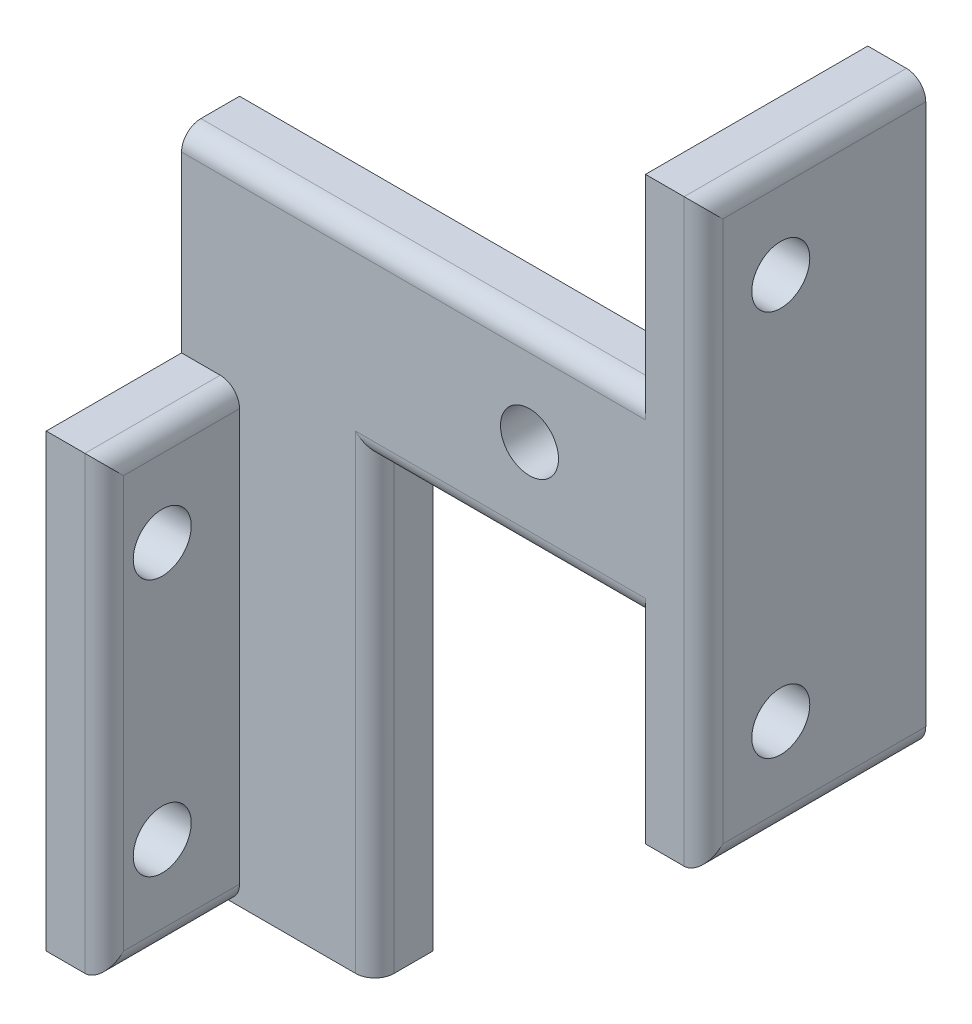
from build123d import *

# Parameters (mm, degrees)
CROQUIS1_W              = 23
CROQUIS1_H              = 33.3
SALIENTE_EXTRUIR2_DEPTH = 7
CROQUIS3_W              = 4
CROQUIS3_H              = 19
CORTAR_EXTRUIR1_DEPTH   = 42.071766458
CROQUIS7_R              = 1.5
SALIENTE_EXTRUIR3_DEPTH = 3
CROQUIS8_W              = 18
CROQUIS8_H              = 10
CROQUIS8_R              = 1.5
SALIENTE_EXTRUIR5_DEPTH = 3
SALIENTE_EXTRUIR6_START = -1
CROQUIS9_W              = 18
CROQUIS9_H              = 10
CROQUIS9_R              = 1.5
SALIENTE_EXTRUIR6_DEPTH = 1
CROQUIS10_W             = 23
CROQUIS10_H             = 10
SALIENTE_EXTRUIR7_DEPTH = 3
CROQUIS11_W             = 19
CROQUIS11_H             = 38
CORTAR_EXTRUIR5_DEPTH   = 57.449003534
CROQUIS15_W             = 7
CROQUIS15_H             = 10
CORTAR_EXTRUIR8_DEPTH   = 58.475994989
CROQUIS16_W             = 7
CROQUIS16_H             = 16
CORTAR_EXTRUIR9_DEPTH   = 1
CROQUIS18_W             = 23
CROQUIS18_H             = 10
CROQUIS18_R             = 1.5
SALIENTE_EXTRUIR8_DEPTH = 3
REDONDEO1_R             = 1
CROQUIS19_W             = 2
CROQUIS19_H             = 11.5
CORTAR_EXTRUIR10_DEPTH  = 67.516839973
CROQUIS20_W             = 11.5
CROQUIS20_H             = 11
CORTAR_EXTRUIR11_DEPTH  = 60.929041374


with BuildPart() as part:
    # Croquis1 → Saliente-Extruir2 (new body)
    with BuildSketch(Plane(origin=(0, 0, 0), x_dir=(0, 0, -1), z_dir=(1, 0, 0))):
        with Locations((-11.5, -16.65)):
            Rectangle(CROQUIS1_W, CROQUIS1_H)
    extrude(amount=SALIENTE_EXTRUIR2_DEPTH)

    # Croquis3 → Cortar-Extruir1 (cut, through all)
    with BuildSketch(Plane(origin=(0, 0, 0), x_dir=(1, 0, 0), z_dir=(0, 1, 0))):
        with Locations((5, -10.5)):
            Rectangle(CROQUIS3_W, CROQUIS3_H)
    extrude(amount=-CORTAR_EXTRUIR1_DEPTH, mode=Mode.SUBTRACT)



with BuildPart() as body_2:
    # Croquis7 → Saliente-Extruir3 (new body)
    with BuildSketch(Plane.ZY):
        Polygon((-7, 0), (-7, -33.3), (0, -33.3), (0, -44.3), (23, -44.3), (23, -33.3), (30, -33.3), (30, 0), align=None)
        with Locations((-4, -28.3)):
            Circle(CROQUIS7_R, mode=Mode.SUBTRACT)
        with Locations((-4, -15)):
            Circle(CROQUIS7_R, mode=Mode.SUBTRACT)
        with Locations((27, -15)):
            Circle(CROQUIS7_R, mode=Mode.SUBTRACT)
        with Locations((27, -28.3)):
            Circle(CROQUIS7_R, mode=Mode.SUBTRACT)
        with Locations((19, -40.3)):
            Circle(CROQUIS7_R, mode=Mode.SUBTRACT)
        with Locations((4, -40.3)):
            Circle(CROQUIS7_R, mode=Mode.SUBTRACT)
    extrude(amount=SALIENTE_EXTRUIR3_DEPTH)


with BuildPart() as part_1:
    add(part.part)

    add(body_2.part)  # Saliente-Extruir5 merges body 2
    # Croquis8 → Saliente-Extruir5 (add)
    with BuildSketch(Plane.XY.offset(23)):
        with Locations((9, -5)):
            Rectangle(CROQUIS8_W, CROQUIS8_H)
        with Locations((15, -5)):
            Circle(CROQUIS8_R, mode=Mode.SUBTRACT)
        with Locations((3, -5)):
            Circle(CROQUIS8_R, mode=Mode.SUBTRACT)
    extrude(amount=-SALIENTE_EXTRUIR5_DEPTH)

    # Croquis9 → Saliente-Extruir6 (add)
    with BuildSketch(Plane(origin=(0, 0, 0), x_dir=(-1, 0, 0), z_dir=(0, 0, -1)).offset(SALIENTE_EXTRUIR6_START)):
        with Locations((-9, -5)):
            Rectangle(CROQUIS9_W, CROQUIS9_H)
        with Locations(Location((-15, -5, 0), (0, 0, 180))):
            Circle(CROQUIS9_R, mode=Mode.SUBTRACT)
    extrude(amount=SALIENTE_EXTRUIR6_DEPTH)

    # Croquis10 → Saliente-Extruir7 (add)
    with BuildSketch(Plane(origin=(18, 0, 0), x_dir=(0, 0, -1), z_dir=(1, 0, 0))):
        with Locations((-11.5, -5)):
            Rectangle(CROQUIS10_W, CROQUIS10_H)
    extrude(amount=SALIENTE_EXTRUIR7_DEPTH)

    # Croquis11 → Cortar-Extruir5 (cut, through all)
    with BuildSketch(Plane(origin=(3, 0, 0), x_dir=(0, 0, -1), z_dir=(1, 0, 0))):
        with Locations((-10.5, -19)):
            Rectangle(CROQUIS11_W, CROQUIS11_H)
    extrude(amount=-CORTAR_EXTRUIR5_DEPTH, mode=Mode.SUBTRACT)

    # Croquis15 → Cortar-Extruir8 (cut, through all)
    with BuildSketch(Plane(origin=(0, 0, 0), x_dir=(0, 0, -1), z_dir=(1, 0, 0))):
        with Locations((-26.5, -5)):
            Rectangle(CROQUIS15_W, CROQUIS15_H)
        with Locations((3.5, -5)):
            Rectangle(CROQUIS15_W, CROQUIS15_H)
    extrude(amount=-CORTAR_EXTRUIR8_DEPTH, mode=Mode.SUBTRACT)

    # Croquis16 → Cortar-Extruir9 (cut)
    with BuildSketch(Plane(origin=(0, 0, 0), x_dir=(-1, 0, 0), z_dir=(0, 0, -1))):
        with Locations((-3.5, -25.3)):
            Rectangle(CROQUIS16_W, CROQUIS16_H)
    extrude(amount=-CORTAR_EXTRUIR9_DEPTH, mode=Mode.SUBTRACT)

    # Croquis18 → Saliente-Extruir8 (add)
    # profile 1 of 3: a face of its own
    with BuildSketch(Plane(origin=(21, 0, 0), x_dir=(0, 0, -1), z_dir=(1, 0, 0))):
        with Locations((-11.5, 5)):
            Rectangle(CROQUIS18_W, CROQUIS18_H)
        with Locations((-19, 5)):
            Circle(CROQUIS18_R, mode=Mode.SUBTRACT)
        with Locations((-4, 5)):
            Circle(CROQUIS18_R, mode=Mode.SUBTRACT)
    # profile 2 of 3: a face of its own
    with BuildSketch(Plane(origin=(21, 0, 0), x_dir=(0, 0, -1), z_dir=(1, 0, 0))):
        with Locations((-11.5, -5)):
            Rectangle(CROQUIS18_W, CROQUIS18_H)
    # profile 3 of 3: a face of its own
    with BuildSketch(Plane(origin=(21, 0, 0), x_dir=(0, 0, -1), z_dir=(1, 0, 0))):
        with Locations((-11.5, -15)):
            Rectangle(CROQUIS18_W, CROQUIS18_H)
        with Locations((-4, -15)):
            Circle(CROQUIS18_R, mode=Mode.SUBTRACT)
        with Locations((-19, -15)):
            Circle(CROQUIS18_R, mode=Mode.SUBTRACT)
    extrude(amount=SALIENTE_EXTRUIR8_DEPTH)

    # Redondeo1
    # the kernel refuses this fillet: 1 mm, written as the material it takes off along each edge
    with BuildSketch(Plane(origin=(0, -33.3, 30), x_dir=(-1, 0, 0), z_dir=(0, 1, 0)), Plane(origin=(7, -33.3, 23), x_dir=(-1, 0, 0), z_dir=(0, 1, 0))) as redondeo1_piece_1:
        with BuildLine():
            CenterArc((REDONDEO1_R, -REDONDEO1_R), REDONDEO1_R, 90, 90)
            Line((0, -REDONDEO1_R), (-REDONDEO1_R * 0.02, -REDONDEO1_R))
            Line((-REDONDEO1_R * 0.02, -REDONDEO1_R), (-REDONDEO1_R * 0.02, REDONDEO1_R * 0.02))
            Line((-REDONDEO1_R * 0.02, REDONDEO1_R * 0.02), (REDONDEO1_R, REDONDEO1_R * 0.02))
            Line((REDONDEO1_R, REDONDEO1_R * 0.02), (REDONDEO1_R, 0))
        make_face()
    extrude(amount=23.3, mode=Mode.SUBTRACT)
    with BuildSketch(Plane(origin=(0, -10, 23), x_dir=(-1, 0, 0), z_dir=(0, 0, 1)), Plane(origin=(0, -10, -7), x_dir=(-1, 0, 0), z_dir=(0, 0, 1)), Plane(origin=(0, -33.3, -7), x_dir=(0, 1, 0), z_dir=(0, 0, 1))) as redondeo1_piece_2:
        with BuildLine():
            CenterArc((REDONDEO1_R, REDONDEO1_R), REDONDEO1_R, 180, 90)
            Line((0, REDONDEO1_R), (-REDONDEO1_R * 0.02, REDONDEO1_R))
            Line((-REDONDEO1_R * 0.02, REDONDEO1_R), (-REDONDEO1_R * 0.02, -REDONDEO1_R * 0.02))
            Line((-REDONDEO1_R * 0.02, -REDONDEO1_R * 0.02), (REDONDEO1_R, -REDONDEO1_R * 0.02))
            Line((REDONDEO1_R, -REDONDEO1_R * 0.02), (REDONDEO1_R, 0))
        make_face()
    extrude(amount=7, mode=Mode.SUBTRACT)
    with BuildSketch(Plane(origin=(24, 10, 23), x_dir=(0, 0, -1), z_dir=(0, -1, 0)), Plane(origin=(24, 10, 0), x_dir=(-1, 0, 0), z_dir=(0, -1, 0))) as redondeo1_piece_3:
        with BuildLine():
            CenterArc((REDONDEO1_R, -REDONDEO1_R), REDONDEO1_R, 90, 90)
            Line((0, -REDONDEO1_R), (-REDONDEO1_R * 0.02, -REDONDEO1_R))
            Line((-REDONDEO1_R * 0.02, -REDONDEO1_R), (-REDONDEO1_R * 0.02, REDONDEO1_R * 0.02))
            Line((-REDONDEO1_R * 0.02, REDONDEO1_R * 0.02), (REDONDEO1_R, REDONDEO1_R * 0.02))
            Line((REDONDEO1_R, REDONDEO1_R * 0.02), (REDONDEO1_R, 0))
        make_face()
    extrude(amount=30, mode=Mode.SUBTRACT)
    with BuildSketch(Plane(origin=(24, 10, 0), x_dir=(-1, 0, 0), z_dir=(0, 0, 1)), Plane(origin=(0, -44.3, 0), x_dir=(0, 1, 0), z_dir=(0, 0, 1))) as redondeo1_piece_4:
        with BuildLine():
            CenterArc((REDONDEO1_R, REDONDEO1_R), REDONDEO1_R, 180, 90)
            Line((0, REDONDEO1_R), (-REDONDEO1_R * 0.02, REDONDEO1_R))
            Line((-REDONDEO1_R * 0.02, REDONDEO1_R), (-REDONDEO1_R * 0.02, -REDONDEO1_R * 0.02))
            Line((-REDONDEO1_R * 0.02, -REDONDEO1_R * 0.02), (REDONDEO1_R, -REDONDEO1_R * 0.02))
            Line((REDONDEO1_R, -REDONDEO1_R * 0.02), (REDONDEO1_R, 0))
        make_face()
    extrude(amount=23, mode=Mode.SUBTRACT)
    with BuildSketch(Plane(origin=(24, -20, 0), x_dir=(-1, 0, 0), z_dir=(0, 0, 1))) as redondeo1_piece_5:
        with BuildLine():
            CenterArc((REDONDEO1_R, -REDONDEO1_R), REDONDEO1_R, 90, 90)
            Line((0, -REDONDEO1_R), (-REDONDEO1_R * 0.02, -REDONDEO1_R))
            Line((-REDONDEO1_R * 0.02, -REDONDEO1_R), (-REDONDEO1_R * 0.02, REDONDEO1_R * 0.02))
            Line((-REDONDEO1_R * 0.02, REDONDEO1_R * 0.02), (REDONDEO1_R, REDONDEO1_R * 0.02))
            Line((REDONDEO1_R, REDONDEO1_R * 0.02), (REDONDEO1_R, 0))
        make_face()
    extrude(amount=23, mode=Mode.SUBTRACT)
    with BuildSketch(Plane(origin=(7, -10, 23), x_dir=(0, 1, 0), z_dir=(1, 0, 0))) as redondeo1_piece_6:
        with BuildLine():
            CenterArc((REDONDEO1_R, -REDONDEO1_R), REDONDEO1_R, 90, 90)
            Line((0, -REDONDEO1_R), (-REDONDEO1_R * 0.02, -REDONDEO1_R))
            Line((-REDONDEO1_R * 0.02, -REDONDEO1_R), (-REDONDEO1_R * 0.02, REDONDEO1_R * 0.02))
            Line((-REDONDEO1_R * 0.02, REDONDEO1_R * 0.02), (REDONDEO1_R, REDONDEO1_R * 0.02))
            Line((REDONDEO1_R, REDONDEO1_R * 0.02), (REDONDEO1_R, 0))
        make_face()
    extrude(amount=14, mode=Mode.SUBTRACT)
    with BuildSketch(Plane(origin=(0, -33.3, 0), x_dir=(0, 0, 1), z_dir=(0, -1, 0))) as redondeo1_piece_7:
        with BuildLine():
            CenterArc((REDONDEO1_R, REDONDEO1_R), REDONDEO1_R, 180, 90)
            Line((0, REDONDEO1_R), (-REDONDEO1_R * 0.02, REDONDEO1_R))
            Line((-REDONDEO1_R * 0.02, REDONDEO1_R), (-REDONDEO1_R * 0.02, -REDONDEO1_R * 0.02))
            Line((-REDONDEO1_R * 0.02, -REDONDEO1_R * 0.02), (REDONDEO1_R, -REDONDEO1_R * 0.02))
            Line((REDONDEO1_R, -REDONDEO1_R * 0.02), (REDONDEO1_R, 0))
        make_face()
    extrude(amount=11, mode=Mode.SUBTRACT)
    with BuildSketch(Plane(origin=(0, -33.3, 23), x_dir=(-1, 0, 0), z_dir=(0, 0, 1))) as redondeo1_piece_8:
        with BuildLine():
            CenterArc((REDONDEO1_R, -REDONDEO1_R), REDONDEO1_R, 90, 90)
            Line((0, -REDONDEO1_R), (-REDONDEO1_R * 0.02, -REDONDEO1_R))
            Line((-REDONDEO1_R * 0.02, -REDONDEO1_R), (-REDONDEO1_R * 0.02, REDONDEO1_R * 0.02))
            Line((-REDONDEO1_R * 0.02, REDONDEO1_R * 0.02), (REDONDEO1_R, REDONDEO1_R * 0.02))
            Line((REDONDEO1_R, REDONDEO1_R * 0.02), (REDONDEO1_R, 0))
        make_face()
    extrude(amount=7, mode=Mode.SUBTRACT)
    with BuildSketch(Plane(origin=(-3, 0, 23), x_dir=(0, -1, 0), z_dir=(1, 0, 0)), Plane(origin=(21, 0, 0), x_dir=(0, -1, 0), z_dir=(-1, 0, 0))) as redondeo1_piece_9:
        with BuildLine():
            CenterArc((REDONDEO1_R, REDONDEO1_R), REDONDEO1_R, 180, 90)
            Line((0, REDONDEO1_R), (-REDONDEO1_R * 0.02, REDONDEO1_R))
            Line((-REDONDEO1_R * 0.02, REDONDEO1_R), (-REDONDEO1_R * 0.02, -REDONDEO1_R * 0.02))
            Line((-REDONDEO1_R * 0.02, -REDONDEO1_R * 0.02), (REDONDEO1_R, -REDONDEO1_R * 0.02))
            Line((REDONDEO1_R, -REDONDEO1_R * 0.02), (REDONDEO1_R, 0))
        make_face()
    extrude(amount=24, mode=Mode.SUBTRACT)
    with BuildSketch(Plane(origin=(0, -10, -7), x_dir=(0, 0, 1), z_dir=(0, -1, 0))) as redondeo1_piece_10:
        with BuildLine():
            CenterArc((REDONDEO1_R, REDONDEO1_R), REDONDEO1_R, 180, 90)
            Line((0, REDONDEO1_R), (-REDONDEO1_R * 0.02, REDONDEO1_R))
            Line((-REDONDEO1_R * 0.02, REDONDEO1_R), (-REDONDEO1_R * 0.02, -REDONDEO1_R * 0.02))
            Line((-REDONDEO1_R * 0.02, -REDONDEO1_R * 0.02), (REDONDEO1_R, -REDONDEO1_R * 0.02))
            Line((REDONDEO1_R, -REDONDEO1_R * 0.02), (REDONDEO1_R, 0))
        make_face()
    extrude(amount=23.3, mode=Mode.SUBTRACT)
    with BuildSketch(Plane(origin=(0, -33.3, 23), x_dir=(-1, 0, 0), z_dir=(0, 0, 1))) as redondeo1_piece_11a_section:
        with BuildLine():
            CenterArc((REDONDEO1_R, -REDONDEO1_R), REDONDEO1_R, 90, 90)
            Line((0, -REDONDEO1_R), (-REDONDEO1_R * 0.02, -REDONDEO1_R))
            Line((-REDONDEO1_R * 0.02, -REDONDEO1_R), (-REDONDEO1_R * 0.02, REDONDEO1_R * 0.02))
            Line((-REDONDEO1_R * 0.02, REDONDEO1_R * 0.02), (REDONDEO1_R, REDONDEO1_R * 0.02))
            Line((REDONDEO1_R, REDONDEO1_R * 0.02), (REDONDEO1_R, 0))
        make_face()
    redondeo1_piece_11a = extrude(amount=9.5, mode=Mode.PRIVATE)
    redondeo1_piece_11a = split(redondeo1_piece_11a, bisect_by=Plane(origin=(-0.226395114, -33.073604886, 30), z_dir=(0, 0, 1)), keep=Keep.TOP, mode=Mode.PRIVATE)
    with BuildSketch(Plane(origin=(0, -35.8, 30), x_dir=(-1, 0, 0), z_dir=(0, 1, 0))) as redondeo1_piece_11b_section:
        with BuildLine():
            CenterArc((REDONDEO1_R, -REDONDEO1_R), REDONDEO1_R, 90, 90)
            Line((0, -REDONDEO1_R), (-REDONDEO1_R * 0.02, -REDONDEO1_R))
            Line((-REDONDEO1_R * 0.02, -REDONDEO1_R), (-REDONDEO1_R * 0.02, REDONDEO1_R * 0.02))
            Line((-REDONDEO1_R * 0.02, REDONDEO1_R * 0.02), (REDONDEO1_R, REDONDEO1_R * 0.02))
            Line((REDONDEO1_R, REDONDEO1_R * 0.02), (REDONDEO1_R, 0))
        make_face()
    redondeo1_piece_11b = extrude(amount=25.8, mode=Mode.PRIVATE)
    redondeo1_piece_11b = split(redondeo1_piece_11b, bisect_by=Plane(origin=(-0.226395114, -33.3, 29.773604886), z_dir=(0, -1, 0)), keep=Keep.TOP, mode=Mode.PRIVATE)
    redondeo1_piece_11 = redondeo1_piece_11a & redondeo1_piece_11b
    add(redondeo1_piece_11, mode=Mode.SUBTRACT)
    with BuildSketch(Plane(origin=(0, -10, 23), x_dir=(-1, 0, 0), z_dir=(0, 0, 1))) as redondeo1_piece_12a_section:
        with BuildLine():
            CenterArc((REDONDEO1_R, REDONDEO1_R), REDONDEO1_R, 180, 90)
            Line((0, REDONDEO1_R), (-REDONDEO1_R * 0.02, REDONDEO1_R))
            Line((-REDONDEO1_R * 0.02, REDONDEO1_R), (-REDONDEO1_R * 0.02, -REDONDEO1_R * 0.02))
            Line((-REDONDEO1_R * 0.02, -REDONDEO1_R * 0.02), (REDONDEO1_R, -REDONDEO1_R * 0.02))
            Line((REDONDEO1_R, -REDONDEO1_R * 0.02), (REDONDEO1_R, 0))
        make_face()
    redondeo1_piece_12a = extrude(amount=9.5, mode=Mode.PRIVATE)
    redondeo1_piece_12a = split(redondeo1_piece_12a, bisect_by=Plane(origin=(-0.226395114, -10.226395114, 30), z_dir=(0, 0, 1)), keep=Keep.TOP, mode=Mode.PRIVATE)
    with BuildSketch(Plane(origin=(0, -33.3, 30), x_dir=(-1, 0, 0), z_dir=(0, 1, 0))) as redondeo1_piece_12b_section:
        with BuildLine():
            CenterArc((REDONDEO1_R, -REDONDEO1_R), REDONDEO1_R, 90, 90)
            Line((0, -REDONDEO1_R), (-REDONDEO1_R * 0.02, -REDONDEO1_R))
            Line((-REDONDEO1_R * 0.02, -REDONDEO1_R), (-REDONDEO1_R * 0.02, REDONDEO1_R * 0.02))
            Line((-REDONDEO1_R * 0.02, REDONDEO1_R * 0.02), (REDONDEO1_R, REDONDEO1_R * 0.02))
            Line((REDONDEO1_R, REDONDEO1_R * 0.02), (REDONDEO1_R, 0))
        make_face()
    redondeo1_piece_12b = extrude(amount=25.8, mode=Mode.PRIVATE)
    redondeo1_piece_12b = split(redondeo1_piece_12b, bisect_by=Plane(origin=(-0.226395114, -10, 29.773604886), z_dir=(0, 1, 0)), keep=Keep.TOP, mode=Mode.PRIVATE)
    redondeo1_piece_12 = redondeo1_piece_12a & redondeo1_piece_12b
    add(redondeo1_piece_12, mode=Mode.SUBTRACT)
    with BuildSketch(Plane(origin=(24, 10, 0), x_dir=(-1, 0, 0), z_dir=(0, 0, 1))) as redondeo1_piece_13a_section:
        with BuildLine():
            CenterArc((REDONDEO1_R, REDONDEO1_R), REDONDEO1_R, 180, 90)
            Line((0, REDONDEO1_R), (-REDONDEO1_R * 0.02, REDONDEO1_R))
            Line((-REDONDEO1_R * 0.02, REDONDEO1_R), (-REDONDEO1_R * 0.02, -REDONDEO1_R * 0.02))
            Line((-REDONDEO1_R * 0.02, -REDONDEO1_R * 0.02), (REDONDEO1_R, -REDONDEO1_R * 0.02))
            Line((REDONDEO1_R, -REDONDEO1_R * 0.02), (REDONDEO1_R, 0))
        make_face()
    redondeo1_piece_13a = extrude(amount=25.5, mode=Mode.PRIVATE)
    redondeo1_piece_13a = split(redondeo1_piece_13a, bisect_by=Plane(origin=(23.773604886, 9.773604886, 23), z_dir=(0, 0, 1)), keep=Keep.TOP, mode=Mode.PRIVATE)
    with BuildSketch(Plane(origin=(24, 12.5, 23), x_dir=(0, 0, -1), z_dir=(0, -1, 0))) as redondeo1_piece_13b_section:
        with BuildLine():
            CenterArc((REDONDEO1_R, -REDONDEO1_R), REDONDEO1_R, 90, 90)
            Line((0, -REDONDEO1_R), (-REDONDEO1_R * 0.02, -REDONDEO1_R))
            Line((-REDONDEO1_R * 0.02, -REDONDEO1_R), (-REDONDEO1_R * 0.02, REDONDEO1_R * 0.02))
            Line((-REDONDEO1_R * 0.02, REDONDEO1_R * 0.02), (REDONDEO1_R, REDONDEO1_R * 0.02))
            Line((REDONDEO1_R, REDONDEO1_R * 0.02), (REDONDEO1_R, 0))
        make_face()
    redondeo1_piece_13b = extrude(amount=32.5, mode=Mode.PRIVATE)
    redondeo1_piece_13b = split(redondeo1_piece_13b, bisect_by=Plane(origin=(23.773604886, 10, 22.773604886), z_dir=(0, 1, 0)), keep=Keep.TOP, mode=Mode.PRIVATE)
    redondeo1_piece_13 = redondeo1_piece_13a & redondeo1_piece_13b
    add(redondeo1_piece_13, mode=Mode.SUBTRACT)
    with BuildSketch(Plane(origin=(24, -20, 0), x_dir=(-1, 0, 0), z_dir=(0, 0, 1))) as redondeo1_piece_14a_section:
        with BuildLine():
            CenterArc((REDONDEO1_R, -REDONDEO1_R), REDONDEO1_R, 90, 90)
            Line((0, -REDONDEO1_R), (-REDONDEO1_R * 0.02, -REDONDEO1_R))
            Line((-REDONDEO1_R * 0.02, -REDONDEO1_R), (-REDONDEO1_R * 0.02, REDONDEO1_R * 0.02))
            Line((-REDONDEO1_R * 0.02, REDONDEO1_R * 0.02), (REDONDEO1_R, REDONDEO1_R * 0.02))
            Line((REDONDEO1_R, REDONDEO1_R * 0.02), (REDONDEO1_R, 0))
        make_face()
    redondeo1_piece_14a = extrude(amount=25.5, mode=Mode.PRIVATE)
    redondeo1_piece_14a = split(redondeo1_piece_14a, bisect_by=Plane(origin=(23.773604886, -19.773604886, 23), z_dir=(0, 0, 1)), keep=Keep.TOP, mode=Mode.PRIVATE)
    with BuildSketch(Plane(origin=(24, 10, 23), x_dir=(0, 0, -1), z_dir=(0, -1, 0))) as redondeo1_piece_14b_section:
        with BuildLine():
            CenterArc((REDONDEO1_R, -REDONDEO1_R), REDONDEO1_R, 90, 90)
            Line((0, -REDONDEO1_R), (-REDONDEO1_R * 0.02, -REDONDEO1_R))
            Line((-REDONDEO1_R * 0.02, -REDONDEO1_R), (-REDONDEO1_R * 0.02, REDONDEO1_R * 0.02))
            Line((-REDONDEO1_R * 0.02, REDONDEO1_R * 0.02), (REDONDEO1_R, REDONDEO1_R * 0.02))
            Line((REDONDEO1_R, REDONDEO1_R * 0.02), (REDONDEO1_R, 0))
        make_face()
    redondeo1_piece_14b = extrude(amount=32.5, mode=Mode.PRIVATE)
    redondeo1_piece_14b = split(redondeo1_piece_14b, bisect_by=Plane(origin=(23.773604886, -20, 22.773604886), z_dir=(0, -1, 0)), keep=Keep.TOP, mode=Mode.PRIVATE)
    redondeo1_piece_14 = redondeo1_piece_14a & redondeo1_piece_14b
    add(redondeo1_piece_14, mode=Mode.SUBTRACT)
    with BuildSketch(Plane(origin=(24, 12.5, 0), x_dir=(-1, 0, 0), z_dir=(0, -1, 0))) as redondeo1_piece_15a_section:
        with BuildLine():
            CenterArc((REDONDEO1_R, -REDONDEO1_R), REDONDEO1_R, 90, 90)
            Line((0, -REDONDEO1_R), (-REDONDEO1_R * 0.02, -REDONDEO1_R))
            Line((-REDONDEO1_R * 0.02, -REDONDEO1_R), (-REDONDEO1_R * 0.02, REDONDEO1_R * 0.02))
            Line((-REDONDEO1_R * 0.02, REDONDEO1_R * 0.02), (REDONDEO1_R, REDONDEO1_R * 0.02))
            Line((REDONDEO1_R, REDONDEO1_R * 0.02), (REDONDEO1_R, 0))
        make_face()
    redondeo1_piece_15a = extrude(amount=32.5, mode=Mode.PRIVATE)
    redondeo1_piece_15a = split(redondeo1_piece_15a, bisect_by=Plane(origin=(23.773604886, 10, 0.226395114), z_dir=(0, 1, 0)), keep=Keep.TOP, mode=Mode.PRIVATE)
    with BuildSketch(Plane(origin=(24, 10, -2.5), x_dir=(-1, 0, 0), z_dir=(0, 0, 1))) as redondeo1_piece_15b_section:
        with BuildLine():
            CenterArc((REDONDEO1_R, REDONDEO1_R), REDONDEO1_R, 180, 90)
            Line((0, REDONDEO1_R), (-REDONDEO1_R * 0.02, REDONDEO1_R))
            Line((-REDONDEO1_R * 0.02, REDONDEO1_R), (-REDONDEO1_R * 0.02, -REDONDEO1_R * 0.02))
            Line((-REDONDEO1_R * 0.02, -REDONDEO1_R * 0.02), (REDONDEO1_R, -REDONDEO1_R * 0.02))
            Line((REDONDEO1_R, -REDONDEO1_R * 0.02), (REDONDEO1_R, 0))
        make_face()
    redondeo1_piece_15b = extrude(amount=25.5, mode=Mode.PRIVATE)
    redondeo1_piece_15b = split(redondeo1_piece_15b, bisect_by=Plane(origin=(23.773604886, 9.773604886, 0), z_dir=(0, 0, -1)), keep=Keep.TOP, mode=Mode.PRIVATE)
    redondeo1_piece_15 = redondeo1_piece_15a & redondeo1_piece_15b
    add(redondeo1_piece_15, mode=Mode.SUBTRACT)
    with BuildSketch(Plane(origin=(24, 10, 0), x_dir=(-1, 0, 0), z_dir=(0, -1, 0))) as redondeo1_piece_16a_section:
        with BuildLine():
            CenterArc((REDONDEO1_R, -REDONDEO1_R), REDONDEO1_R, 90, 90)
            Line((0, -REDONDEO1_R), (-REDONDEO1_R * 0.02, -REDONDEO1_R))
            Line((-REDONDEO1_R * 0.02, -REDONDEO1_R), (-REDONDEO1_R * 0.02, REDONDEO1_R * 0.02))
            Line((-REDONDEO1_R * 0.02, REDONDEO1_R * 0.02), (REDONDEO1_R, REDONDEO1_R * 0.02))
            Line((REDONDEO1_R, REDONDEO1_R * 0.02), (REDONDEO1_R, 0))
        make_face()
    redondeo1_piece_16a = extrude(amount=32.5, mode=Mode.PRIVATE)
    redondeo1_piece_16a = split(redondeo1_piece_16a, bisect_by=Plane(origin=(23.773604886, -20, 0.226395114), z_dir=(0, -1, 0)), keep=Keep.TOP, mode=Mode.PRIVATE)
    with BuildSketch(Plane(origin=(24, -20, -2.5), x_dir=(-1, 0, 0), z_dir=(0, 0, 1))) as redondeo1_piece_16b_section:
        with BuildLine():
            CenterArc((REDONDEO1_R, -REDONDEO1_R), REDONDEO1_R, 90, 90)
            Line((0, -REDONDEO1_R), (-REDONDEO1_R * 0.02, -REDONDEO1_R))
            Line((-REDONDEO1_R * 0.02, -REDONDEO1_R), (-REDONDEO1_R * 0.02, REDONDEO1_R * 0.02))
            Line((-REDONDEO1_R * 0.02, REDONDEO1_R * 0.02), (REDONDEO1_R, REDONDEO1_R * 0.02))
            Line((REDONDEO1_R, REDONDEO1_R * 0.02), (REDONDEO1_R, 0))
        make_face()
    redondeo1_piece_16b = extrude(amount=25.5, mode=Mode.PRIVATE)
    redondeo1_piece_16b = split(redondeo1_piece_16b, bisect_by=Plane(origin=(23.773604886, -19.773604886, 0), z_dir=(0, 0, -1)), keep=Keep.TOP, mode=Mode.PRIVATE)
    redondeo1_piece_16 = redondeo1_piece_16a & redondeo1_piece_16b
    add(redondeo1_piece_16, mode=Mode.SUBTRACT)
    with BuildSketch(Plane(origin=(4.5, -10, 23), x_dir=(0, 1, 0), z_dir=(1, 0, 0))) as redondeo1_piece_17a_section:
        with BuildLine():
            CenterArc((REDONDEO1_R, -REDONDEO1_R), REDONDEO1_R, 90, 90)
            Line((0, -REDONDEO1_R), (-REDONDEO1_R * 0.02, -REDONDEO1_R))
            Line((-REDONDEO1_R * 0.02, -REDONDEO1_R), (-REDONDEO1_R * 0.02, REDONDEO1_R * 0.02))
            Line((-REDONDEO1_R * 0.02, REDONDEO1_R * 0.02), (REDONDEO1_R, REDONDEO1_R * 0.02))
            Line((REDONDEO1_R, REDONDEO1_R * 0.02), (REDONDEO1_R, 0))
        make_face()
    redondeo1_piece_17a = extrude(amount=16.5, mode=Mode.PRIVATE)
    redondeo1_piece_17a = split(redondeo1_piece_17a, bisect_by=Plane(origin=(7, -9.773604886, 22.773604886), z_dir=(-1, 0, 0)), keep=Keep.TOP, mode=Mode.PRIVATE)
    with BuildSketch(Plane(origin=(7, -33.3, 23), x_dir=(-1, 0, 0), z_dir=(0, 1, 0))) as redondeo1_piece_17b_section:
        with BuildLine():
            CenterArc((REDONDEO1_R, -REDONDEO1_R), REDONDEO1_R, 90, 90)
            Line((0, -REDONDEO1_R), (-REDONDEO1_R * 0.02, -REDONDEO1_R))
            Line((-REDONDEO1_R * 0.02, -REDONDEO1_R), (-REDONDEO1_R * 0.02, REDONDEO1_R * 0.02))
            Line((-REDONDEO1_R * 0.02, REDONDEO1_R * 0.02), (REDONDEO1_R, REDONDEO1_R * 0.02))
            Line((REDONDEO1_R, REDONDEO1_R * 0.02), (REDONDEO1_R, 0))
        make_face()
    redondeo1_piece_17b = extrude(amount=25.8, mode=Mode.PRIVATE)
    redondeo1_piece_17b = split(redondeo1_piece_17b, bisect_by=Plane(origin=(6.773604886, -10, 22.773604886), z_dir=(0, 1, 0)), keep=Keep.TOP, mode=Mode.PRIVATE)
    redondeo1_piece_17 = redondeo1_piece_17a & redondeo1_piece_17b
    add(redondeo1_piece_17, mode=Mode.SUBTRACT)
    with BuildSketch(Plane(origin=(0, -33.3, -7), x_dir=(0, 1, 0), z_dir=(0, 0, 1))) as redondeo1_piece_18a_section:
        with BuildLine():
            CenterArc((REDONDEO1_R, REDONDEO1_R), REDONDEO1_R, 180, 90)
            Line((0, REDONDEO1_R), (-REDONDEO1_R * 0.02, REDONDEO1_R))
            Line((-REDONDEO1_R * 0.02, REDONDEO1_R), (-REDONDEO1_R * 0.02, -REDONDEO1_R * 0.02))
            Line((-REDONDEO1_R * 0.02, -REDONDEO1_R * 0.02), (REDONDEO1_R, -REDONDEO1_R * 0.02))
            Line((REDONDEO1_R, -REDONDEO1_R * 0.02), (REDONDEO1_R, 0))
        make_face()
    redondeo1_piece_18a = extrude(amount=9.5, mode=Mode.PRIVATE)
    redondeo1_piece_18a = split(redondeo1_piece_18a, bisect_by=Plane(origin=(-0.226395114, -33.073604886, 0), z_dir=(0, 0, 1)), keep=Keep.TOP, mode=Mode.PRIVATE)
    with BuildSketch(Plane(origin=(0, -30.8, 0), x_dir=(0, 0, 1), z_dir=(0, -1, 0))) as redondeo1_piece_18b_section:
        with BuildLine():
            CenterArc((REDONDEO1_R, REDONDEO1_R), REDONDEO1_R, 180, 90)
            Line((0, REDONDEO1_R), (-REDONDEO1_R * 0.02, REDONDEO1_R))
            Line((-REDONDEO1_R * 0.02, REDONDEO1_R), (-REDONDEO1_R * 0.02, -REDONDEO1_R * 0.02))
            Line((-REDONDEO1_R * 0.02, -REDONDEO1_R * 0.02), (REDONDEO1_R, -REDONDEO1_R * 0.02))
            Line((REDONDEO1_R, -REDONDEO1_R * 0.02), (REDONDEO1_R, 0))
        make_face()
    redondeo1_piece_18b = extrude(amount=13.5, mode=Mode.PRIVATE)
    redondeo1_piece_18b = split(redondeo1_piece_18b, bisect_by=Plane(origin=(-0.226395114, -33.3, 0.226395114), z_dir=(0, 1, 0)), keep=Keep.TOP, mode=Mode.PRIVATE)
    redondeo1_piece_18 = redondeo1_piece_18a & redondeo1_piece_18b
    add(redondeo1_piece_18, mode=Mode.SUBTRACT)
    with BuildSketch(Plane(origin=(0, -33.3, 0), x_dir=(0, 0, 1), z_dir=(0, -1, 0))) as redondeo1_piece_19a_section:
        with BuildLine():
            CenterArc((REDONDEO1_R, REDONDEO1_R), REDONDEO1_R, 180, 90)
            Line((0, REDONDEO1_R), (-REDONDEO1_R * 0.02, REDONDEO1_R))
            Line((-REDONDEO1_R * 0.02, REDONDEO1_R), (-REDONDEO1_R * 0.02, -REDONDEO1_R * 0.02))
            Line((-REDONDEO1_R * 0.02, -REDONDEO1_R * 0.02), (REDONDEO1_R, -REDONDEO1_R * 0.02))
            Line((REDONDEO1_R, -REDONDEO1_R * 0.02), (REDONDEO1_R, 0))
        make_face()
    redondeo1_piece_19a = extrude(amount=13.5, mode=Mode.PRIVATE)
    redondeo1_piece_19a = split(redondeo1_piece_19a, bisect_by=Plane(origin=(-0.226395114, -44.3, 0.226395114), z_dir=(0, -1, 0)), keep=Keep.TOP, mode=Mode.PRIVATE)
    with BuildSketch(Plane(origin=(0, -44.3, -2.5), x_dir=(0, 1, 0), z_dir=(0, 0, 1))) as redondeo1_piece_19b_section:
        with BuildLine():
            CenterArc((REDONDEO1_R, REDONDEO1_R), REDONDEO1_R, 180, 90)
            Line((0, REDONDEO1_R), (-REDONDEO1_R * 0.02, REDONDEO1_R))
            Line((-REDONDEO1_R * 0.02, REDONDEO1_R), (-REDONDEO1_R * 0.02, -REDONDEO1_R * 0.02))
            Line((-REDONDEO1_R * 0.02, -REDONDEO1_R * 0.02), (REDONDEO1_R, -REDONDEO1_R * 0.02))
            Line((REDONDEO1_R, -REDONDEO1_R * 0.02), (REDONDEO1_R, 0))
        make_face()
    redondeo1_piece_19b = extrude(amount=25.5, mode=Mode.PRIVATE)
    redondeo1_piece_19b = split(redondeo1_piece_19b, bisect_by=Plane(origin=(-0.226395114, -44.073604886, 0), z_dir=(0, 0, -1)), keep=Keep.TOP, mode=Mode.PRIVATE)
    redondeo1_piece_19 = redondeo1_piece_19a & redondeo1_piece_19b
    add(redondeo1_piece_19, mode=Mode.SUBTRACT)
    with BuildSketch(Plane(origin=(0, -10, -9.5), x_dir=(-1, 0, 0), z_dir=(0, 0, 1))) as redondeo1_piece_20a_section:
        with BuildLine():
            CenterArc((REDONDEO1_R, REDONDEO1_R), REDONDEO1_R, 180, 90)
            Line((0, REDONDEO1_R), (-REDONDEO1_R * 0.02, REDONDEO1_R))
            Line((-REDONDEO1_R * 0.02, REDONDEO1_R), (-REDONDEO1_R * 0.02, -REDONDEO1_R * 0.02))
            Line((-REDONDEO1_R * 0.02, -REDONDEO1_R * 0.02), (REDONDEO1_R, -REDONDEO1_R * 0.02))
            Line((REDONDEO1_R, -REDONDEO1_R * 0.02), (REDONDEO1_R, 0))
        make_face()
    redondeo1_piece_20a = extrude(amount=9.5, mode=Mode.PRIVATE)
    redondeo1_piece_20a = split(redondeo1_piece_20a, bisect_by=Plane(origin=(-0.226395114, -10.226395114, -7), z_dir=(0, 0, -1)), keep=Keep.TOP, mode=Mode.PRIVATE)
    with BuildSketch(Plane(origin=(0, -7.5, -7), x_dir=(0, 0, 1), z_dir=(0, -1, 0))) as redondeo1_piece_20b_section:
        with BuildLine():
            CenterArc((REDONDEO1_R, REDONDEO1_R), REDONDEO1_R, 180, 90)
            Line((0, REDONDEO1_R), (-REDONDEO1_R * 0.02, REDONDEO1_R))
            Line((-REDONDEO1_R * 0.02, REDONDEO1_R), (-REDONDEO1_R * 0.02, -REDONDEO1_R * 0.02))
            Line((-REDONDEO1_R * 0.02, -REDONDEO1_R * 0.02), (REDONDEO1_R, -REDONDEO1_R * 0.02))
            Line((REDONDEO1_R, -REDONDEO1_R * 0.02), (REDONDEO1_R, 0))
        make_face()
    redondeo1_piece_20b = extrude(amount=25.8, mode=Mode.PRIVATE)
    redondeo1_piece_20b = split(redondeo1_piece_20b, bisect_by=Plane(origin=(-0.226395114, -10, -6.773604886), z_dir=(0, 1, 0)), keep=Keep.TOP, mode=Mode.PRIVATE)
    redondeo1_piece_20 = redondeo1_piece_20a & redondeo1_piece_20b
    add(redondeo1_piece_20, mode=Mode.SUBTRACT)
    with BuildSketch(Plane(origin=(0, -10, -7), x_dir=(0, 0, 1), z_dir=(0, -1, 0))) as redondeo1_piece_21a_section:
        with BuildLine():
            CenterArc((REDONDEO1_R, REDONDEO1_R), REDONDEO1_R, 180, 90)
            Line((0, REDONDEO1_R), (-REDONDEO1_R * 0.02, REDONDEO1_R))
            Line((-REDONDEO1_R * 0.02, REDONDEO1_R), (-REDONDEO1_R * 0.02, -REDONDEO1_R * 0.02))
            Line((-REDONDEO1_R * 0.02, -REDONDEO1_R * 0.02), (REDONDEO1_R, -REDONDEO1_R * 0.02))
            Line((REDONDEO1_R, -REDONDEO1_R * 0.02), (REDONDEO1_R, 0))
        make_face()
    redondeo1_piece_21a = extrude(amount=25.8, mode=Mode.PRIVATE)
    redondeo1_piece_21a = split(redondeo1_piece_21a, bisect_by=Plane(origin=(-0.226395114, -33.3, -6.773604886), z_dir=(0, -1, 0)), keep=Keep.TOP, mode=Mode.PRIVATE)
    with BuildSketch(Plane(origin=(0, -33.3, -9.5), x_dir=(0, 1, 0), z_dir=(0, 0, 1))) as redondeo1_piece_21b_section:
        with BuildLine():
            CenterArc((REDONDEO1_R, REDONDEO1_R), REDONDEO1_R, 180, 90)
            Line((0, REDONDEO1_R), (-REDONDEO1_R * 0.02, REDONDEO1_R))
            Line((-REDONDEO1_R * 0.02, REDONDEO1_R), (-REDONDEO1_R * 0.02, -REDONDEO1_R * 0.02))
            Line((-REDONDEO1_R * 0.02, -REDONDEO1_R * 0.02), (REDONDEO1_R, -REDONDEO1_R * 0.02))
            Line((REDONDEO1_R, -REDONDEO1_R * 0.02), (REDONDEO1_R, 0))
        make_face()
    redondeo1_piece_21b = extrude(amount=9.5, mode=Mode.PRIVATE)
    redondeo1_piece_21b = split(redondeo1_piece_21b, bisect_by=Plane(origin=(-0.226395114, -33.073604886, -7), z_dir=(0, 0, -1)), keep=Keep.TOP, mode=Mode.PRIVATE)
    redondeo1_piece_21 = redondeo1_piece_21a & redondeo1_piece_21b
    add(redondeo1_piece_21, mode=Mode.SUBTRACT)

    # Croquis19 → Cortar-Extruir10 (cut, through all)
    with BuildSketch(Plane(origin=(0, -44.3, 0), x_dir=(-1, 0, 0), z_dir=(0, -1, 0))):
        Polygon((-24, -11.5), (1, -11.5), (1, 0), (3, 0), (3, 7), (-24, 7), align=None)
        with Locations((2, -5.75)):
            Rectangle(CROQUIS19_W, CROQUIS19_H)
    extrude(amount=-CORTAR_EXTRUIR10_DEPTH, mode=Mode.SUBTRACT)

    # Croquis20 → Cortar-Extruir11 (cut, through all)
    with BuildSketch(Plane(origin=(24, 0, 0), x_dir=(0, 0, -1), z_dir=(1, 0, 0))):
        with Locations((-17.25, -38.8)):
            Rectangle(CROQUIS20_W, CROQUIS20_H)
    extrude(amount=-CORTAR_EXTRUIR11_DEPTH, mode=Mode.SUBTRACT)


solid = part_1.part
